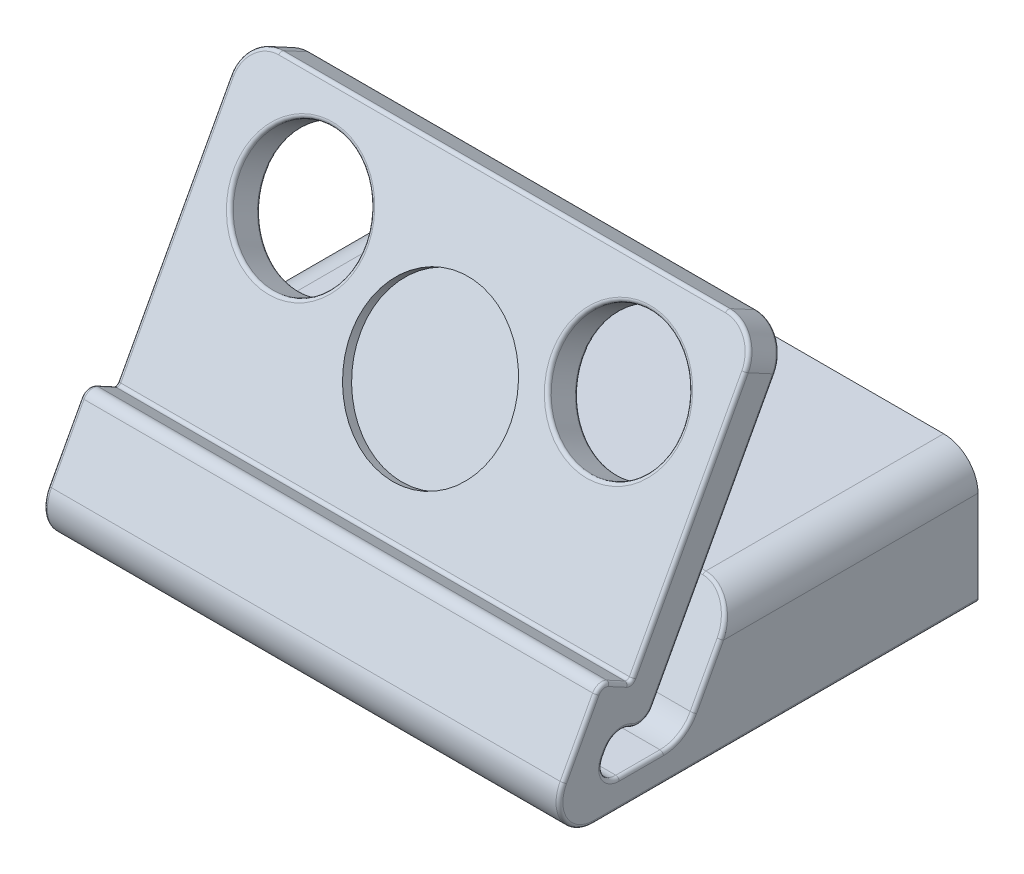
from build123d import *

# Parameters (mm, degrees)
BOSS_EXTRUDE1_DEPTH = 150
FILLET1_R           = 10
FILLET2_R           = 5
FILLET3_R           = 3
SKETCH3_R           = 18.5
CUT_EXTRUDE1_DEPTH  = 20
CUT_EXTRUDE2_DEPTH  = 3
SKETCH5_W           = 138.941506405
SKETCH5_H           = 66.724235053
CUT_EXTRUDE3_DEPTH  = 10
FILLET4_R           = 1
FILLET5_R           = 1
FILLET6_R           = 1


with BuildPart() as part:
    # Sketch2 → Boss-Extrude1 (new body)
    with BuildSketch(Plane(origin=(0, 0, 0), x_dir=(0, 0, -1), z_dir=(1, 0, 0))):
        Polygon((68.899985772, -29.408365653), (-59.641908206, -29.408365653), (-40.821289326, 5.515456547), (-32.018208056, 0.771432923), (5.933980937, 71.196083087), (14.737062208, 66.452059462), (-27.959150409, -12.775671971), (-36.76223168, -8.031648347), (-43.865040317, -21.211726406), (-16.683835655, -21.211726406), (-0.862289836, 8.146970916), (68.899985772, 8.146970916), align=None)
    extrude(amount=-BOSS_EXTRUDE1_DEPTH)

    # Fillet1
    fillet1_edges = [part.edges().sort_by_distance(p)[0] for p in [
        (0, 68.824071275, -10.335521572),
        (0, 8.146970916, -34.018847968),
        (-75, -29.408365653, 59.641908206),
        (-75, -21.211726406, 16.683835655),
        (-150, 68.824071275, -10.335521572),
        (-150, 8.146970916, -34.018847968),
    ]]
    fillet(fillet1_edges, radius=FILLET1_R)

    # Fillet2
    fillet2_edges = [part.edges().sort_by_distance(p)[0] for p in [
        (-75, -12.775671971, 27.959150409),
        (-75, -8.031648347, 36.76223168),
        (-75, -21.211726406, 43.865040317),
    ]]
    fillet(fillet2_edges, radius=FILLET2_R - 0.0001)  # a hair under: the kernel refuses the full size

    # Fillet3
    fillet3_edges = [part.edges().sort_by_distance(p)[0] for p in [
        (-75, 5.515456547, 40.821289326),
    ]]
    fillet(fillet3_edges, radius=FILLET3_R)

    # Sketch3 → Cut-Extrude1 (cut)
    with BuildSketch(Plane(origin=(0, 13.54506906, 25.134432962), x_dir=(1, 0, 0), z_dir=(0, 0.47440236241216066, 0.88030812704289))):
        with Locations(Location((-121.257910201, 38.302153496, 0), (0, 0, 270))):
            Circle(SKETCH3_R)
        with Locations(Location((-28.742089799, 38.302153496, 0), (0, 0, 270))):
            Circle(SKETCH3_R)
    extrude(amount=-CUT_EXTRUDE1_DEPTH, mode=Mode.SUBTRACT)

    # Sketch3<3> → Cut-Extrude2 (cut)
    with BuildSketch(Plane(origin=(0, 13.54506906, 25.134432962), x_dir=(1, 0, 0), z_dir=(0, 0.47440236241216066, 0.88030812704289))):
        with BuildLine():
            ThreePointArc((-51.861291063, 20.48958513), (-58.638462003, 36.851123127), (-75, 43.628294067))
            Line((-75, 43.628294067), (-75, -2.649123807))
            ThreePointArc((-75, -2.649123807), (-58.638462003, 4.128047133), (-51.861291063, 20.48958513))
        make_face()
        with BuildLine():
            Line((-75, -2.649123807), (-75, 43.628294067))
            ThreePointArc((-75, 43.628294067), (-98.138708937, 20.48958513), (-75, -2.649123807))
        make_face()
    extrude(amount=-CUT_EXTRUDE2_DEPTH, mode=Mode.SUBTRACT)

    # Sketch5 → Cut-Extrude3 (cut)
    with BuildSketch(Plane.XZ.offset(29.408365653)):
        with Locations((-74.676880217, -29.894757954)):
            Rectangle(SKETCH5_W, SKETCH5_H)
    extrude(amount=-CUT_EXTRUDE3_DEPTH, mode=Mode.SUBTRACT)

    # Fillet4
    fillet4_edges = [part.edges().sort_by_distance(p)[0] for p in [
        (-75, 0.771432923, 32.018208056),
    ]]
    fillet(fillet4_edges, radius=FILLET4_R)

    # Fillet5
    fillet5_edges = [part.edges().sort_by_distance(p)[0] for p in [
        (-121.257910201, 58.804442792, -10.615724117),
        (-121.257910201, 63.548466417, -1.812642847),
        (-28.742089799, 58.804442792, -10.615724117),
        (-28.742089799, 63.548466417, -1.812642847),
    ]]
    fillet(fillet5_edges, radius=FILLET5_R)

    # Fillet6
    fillet6_edges = [part.edges().sort_by_distance(p)[0] for p in [
        (-150, 2.669042373, 35.539440564),
        (0, 2.669042373, 35.539440564),
        (0, 1.168218439, 32.137095102),
        (-150, 1.168218439, 32.137095102),
        (0, -8.904389557, 10.051351532),
        (-75, 8.146970916, 0.862289836),
        (-150, -8.904389557, 10.051351532),
        (-2.70851669, 4.990527822, 2.563312483),
        (-147.29148331, 4.990527822, 2.563312483),
        (0, -21.211726406, 29.072649697),
        (-150, -21.211726406, 29.072649697),
        (-150, -29.408365653, -13.0033927),
        (-150, 32.022371433, 15.17692419),
        (-150, -24.534756379, 51.479242424),
        (0, 32.022371433, 15.17692419),
        (0, -29.408365653, -13.0033927),
        (0, -24.534756379, 51.479242424),
        (-75, 66.452059462, -14.737062208),
        (-75, 71.196083087, -5.933980937),
        (-2.928932188, 68.617720278, -4.544488588),
        (-147.071067812, 68.617720278, -4.544488588),
        (-2.928932188, 63.873696654, -13.347569858),
        (-147.071067812, 63.873696654, -13.347569858),
        (0, -19.797768458, 17.52805478),
        (-150, -19.797768458, 17.52805478),
        (0, -13.136481493, 39.513251271),
        (0, 24.637379413, 7.797073727),
        (0, -10.791784071, 28.55357375),
        (-150, 24.637379413, 7.797073727),
        (-150, -13.136481493, 39.513251271),
        (-150, -10.791784071, 28.55357375),
        (0, -10.015536248, 36.167808339),
        (-150, -10.015536248, 36.167808339),
        (0, -18.774970505, 39.783789052),
        (-150, -18.774970505, 39.783789052),
        (0, -5.894904931, 46.970389028),
        (0, 4.3251, 40.464628188),
        (-150, -5.894904931, 46.970389028),
        (-150, 4.3251, 40.464628188),
    ]]
    fillet(fillet6_edges, radius=FILLET6_R)


solid = part.part
